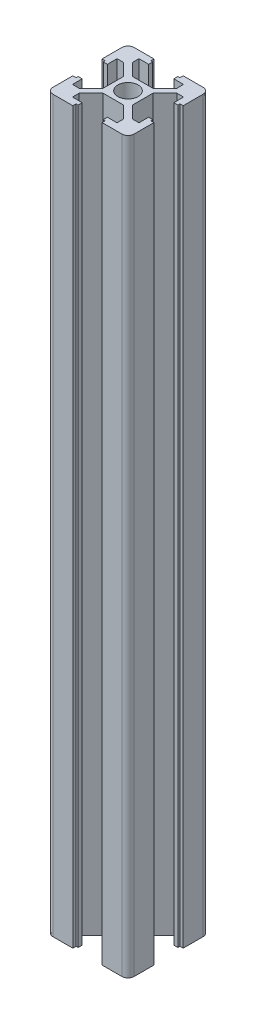
from build123d import *

# Parameters (mm, degrees)
SKETCH_1_R      = 2.5
EXTRUDE_1_DEPTH = 180


with BuildPart() as part:
    # 草图1 → 凸台-拉伸1 (new body)
    with BuildSketch(Plane(origin=(0, 0, 0), x_dir=(1, 0, 0), z_dir=(0, 1, 0))):
        with BuildLine():
            Line((-4.415608984, 3.873972711), (-4.415608984, -1.204706946))
            Line((-4.415608984, -1.204706946), (-7.376269156, -4.165367117))
            Line((-7.376269156, -4.165367117), (-9.015608984, -4.165367117))
            Line((-9.015608984, -4.165367117), (-9.015608984, -1.765367117))
            Line((-9.015608984, -1.765367117), (-10.015608984, -1.765367117))
            Line((-10.015608984, -1.765367117), (-10.015608984, -2.265367117))
            Line((-10.015608984, -2.265367117), (-10.815608984, -2.265367117))
            Line((-10.815608984, -2.265367117), (-10.815608984, -7.165367117))
            ThreePointArc((-10.815608984, -7.165367117), (-10.376269156, -8.226027289), (-9.315608984, -8.665367117))
            Line((-9.315608984, -8.665367117), (-4.415608984, -8.665367117))
            Line((-4.415608984, -8.665367117), (-4.415608984, -7.865367117))
            Line((-4.415608984, -7.865367117), (-3.915608984, -7.865367117))
            Line((-3.915608984, -7.865367117), (-3.915608984, -6.865367117))
            Line((-3.915608984, -6.865367117), (-6.315608984, -6.865367117))
            Line((-6.315608984, -6.865367117), (-6.315608984, -5.226027289))
            Line((-6.315608984, -5.226027289), (-3.354948812, -2.265367117))
            Line((-3.354948812, -2.265367117), (1.723730844, -2.265367117))
            Line((1.723730844, -2.265367117), (4.684391016, -5.226027289))
            Line((4.684391016, -5.226027289), (4.684391016, -6.865367117))
            Line((4.684391016, -6.865367117), (2.284391016, -6.865367117))
            Line((2.284391016, -6.865367117), (2.284391016, -7.865367117))
            Line((2.284391016, -7.865367117), (2.784391016, -7.865367117))
            Line((2.784391016, -7.865367117), (2.784391016, -8.665367117))
            Line((2.784391016, -8.665367117), (7.684391016, -8.665367117))
            ThreePointArc((7.684391016, -8.665367117), (8.745051188, -8.226027289), (9.184391016, -7.165367117))
            Line((9.184391016, -7.165367117), (9.184391016, -2.265367117))
            Line((9.184391016, -2.265367117), (8.384391016, -2.265367117))
            Line((8.384391016, -2.265367117), (8.384391016, -1.765367117))
            Line((8.384391016, -1.765367117), (7.384391016, -1.765367117))
            Line((7.384391016, -1.765367117), (7.384391016, -4.165367117))
            Line((7.384391016, -4.165367117), (5.745051188, -4.165367117))
            Line((5.745051188, -4.165367117), (2.784391016, -1.204706946))
            Line((2.784391016, -1.204706946), (2.784391016, 3.873972711))
            Line((2.784391016, 3.873972711), (5.745051188, 6.834632883))
            Line((5.745051188, 6.834632883), (7.384391016, 6.834632883))
            Line((7.384391016, 6.834632883), (7.384391016, 4.434632883))
            Line((7.384391016, 4.434632883), (8.384391016, 4.434632883))
            Line((8.384391016, 4.434632883), (8.384391016, 4.934632883))
            Line((8.384391016, 4.934632883), (9.184391016, 4.934632883))
            Line((9.184391016, 4.934632883), (9.184391016, 9.834632883))
            ThreePointArc((9.184391016, 9.834632883), (8.745051188, 10.895293054), (7.684391016, 11.334632883))
            Line((7.684391016, 11.334632883), (2.784391016, 11.334632883))
            Line((2.784391016, 11.334632883), (2.784391016, 10.534632883))
            Line((2.784391016, 10.534632883), (2.284391016, 10.534632883))
            Line((2.284391016, 10.534632883), (2.284391016, 9.534632883))
            Line((2.284391016, 9.534632883), (4.684391016, 9.534632883))
            Line((4.684391016, 9.534632883), (4.684391016, 7.895293054))
            Line((4.684391016, 7.895293054), (1.723730844, 4.934632883))
            Line((1.723730844, 4.934632883), (-3.354948812, 4.934632883))
            Line((-3.354948812, 4.934632883), (-6.315608984, 7.895293054))
            Line((-6.315608984, 7.895293054), (-6.315608984, 9.534632883))
            Line((-6.315608984, 9.534632883), (-3.915608984, 9.534632883))
            Line((-3.915608984, 9.534632883), (-3.915608984, 10.534632883))
            Line((-3.915608984, 10.534632883), (-4.415608984, 10.534632883))
            Line((-4.415608984, 10.534632883), (-4.415608984, 11.334632883))
            Line((-4.415608984, 11.334632883), (-9.315608984, 11.334632883))
            ThreePointArc((-9.315608984, 11.334632883), (-10.376269156, 10.895293054), (-10.815608984, 9.834632883))
            Line((-10.815608984, 9.834632883), (-10.815608984, 4.934632883))
            Line((-10.815608984, 4.934632883), (-10.015608984, 4.934632883))
            Line((-10.015608984, 4.934632883), (-10.015608984, 4.434632883))
            Line((-10.015608984, 4.434632883), (-9.015608984, 4.434632883))
            Line((-9.015608984, 4.434632883), (-9.015608984, 6.834632883))
            Line((-9.015608984, 6.834632883), (-7.376269156, 6.834632883))
            Line((-7.376269156, 6.834632883), (-4.415608984, 3.873972711))
        make_face()
        with Locations((-0.815608984, 1.334632883)):
            Circle(SKETCH_1_R, mode=Mode.SUBTRACT)
    extrude(amount=EXTRUDE_1_DEPTH)


solid = part.part
